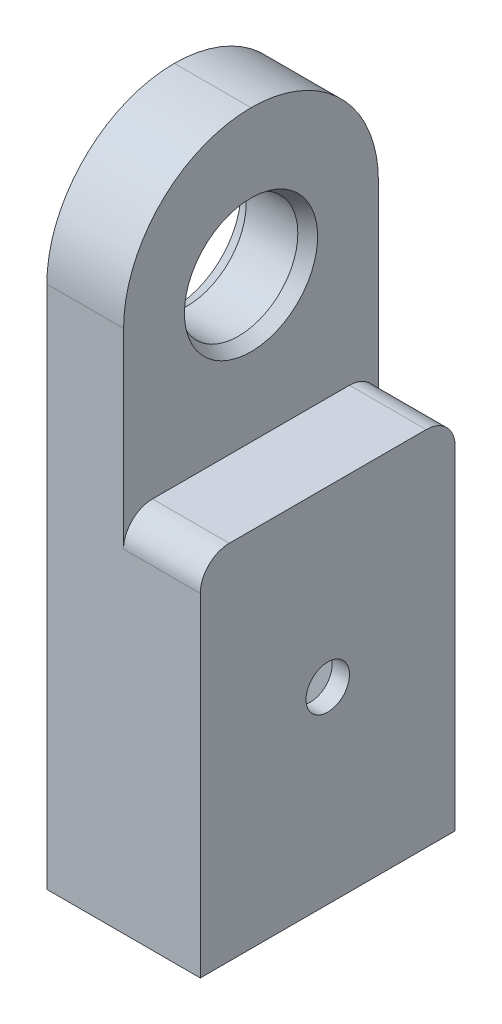
from build123d import *
from OCP.BRepFilletAPI import BRepFilletAPI_MakeChamfer

# Parameters (mm, degrees)
SKETCH1_W           = 10.6
SKETCH1_H           = 17.6
BOSS_EXTRUDE1_DEPTH = 25
SKETCH2_W           = 8.2
SKETCH2_H           = 15.2
CUT_EXTRUDE1_DEPTH  = 23
SKETCH4_W           = 5.3
SKETCH4_H           = 17.6
BOSS_EXTRUDE2_DEPTH = 20
CUT_EXTRUDE2_REACH  = 48.158
SKETCH5_R           = 4.1
FILLET1_R           = 8.8
FILLET2_R           = 2
SKETCH6_R           = 1.5
CUT_EXTRUDE3_DEPTH  = 48.061661679
CHAMFER1_SIZE       = 0.5
CHAMFER1_SIZE2      = 0.866025404


with BuildPart() as part:
    # Sketch1 → Boss-Extrude1 (new body)
    with BuildSketch(Plane(origin=(0, 0, 0), x_dir=(1, 0, 0), z_dir=(0, 1, 0))):
        Rectangle(SKETCH1_W, SKETCH1_H)
    extrude(amount=BOSS_EXTRUDE1_DEPTH)

    # Sketch2 → Cut-Extrude1 (cut)
    with BuildSketch(Plane.XZ):
        Rectangle(SKETCH2_W, SKETCH2_H)
    extrude(amount=-CUT_EXTRUDE1_DEPTH, mode=Mode.SUBTRACT)

    # Sketch4 → Boss-Extrude2 (add)
    with BuildSketch(Plane(origin=(0, 25, 0), x_dir=(1, 0, 0), z_dir=(0, 1, 0))):
        with Locations((-2.65, 0)):
            Rectangle(SKETCH4_W, SKETCH4_H)
    extrude(amount=BOSS_EXTRUDE2_DEPTH)

    # Sketch5 → Cut-Extrude2 (cut, up to next)
    with BuildSketch(Plane(origin=(0, 0, 0), x_dir=(0, 0, -1), z_dir=(1, 0, 0)), mode=Mode.PRIVATE) as cut_extrude2_sk1:
        with Locations((0, 35)):
            Circle(SKETCH5_R)
    cut_extrude2_tool1 = extrude(cut_extrude2_sk1.sketch, amount=-CUT_EXTRUDE2_REACH, mode=Mode.PRIVATE) & part.part
    add(cut_extrude2_tool1.solids().sort_by_distance((0, 35, 0))[0], mode=Mode.SUBTRACT)

    # Fillet1
    fillet1_edges = [part.edges().sort_by_distance(p)[0] for p in [
        (-2.65, 45, -8.8),
        (-2.65, 45, 8.8),
    ]]
    fillet(fillet1_edges, radius=FILLET1_R - 0.0001)  # a hair under: the kernel refuses the full size

    # Fillet2
    fillet2_edges = [part.edges().sort_by_distance(p)[0] for p in [
        (2.65, 25, 8.8),
        (2.65, 25, -8.8),
    ]]
    fillet(fillet2_edges, radius=FILLET2_R)

    # Sketch6 → Cut-Extrude3 (cut, through all)
    with BuildSketch(Plane(origin=(5.3, 0, 0), x_dir=(0, 0, -1), z_dir=(1, 0, 0))):
        with Locations((0, 13)):
            Circle(SKETCH6_R)
    extrude(amount=-CUT_EXTRUDE3_DEPTH, mode=Mode.SUBTRACT)

    # Chamfer1: one chamfer whose edges measure the first distance from different faces: ONE call of the kernel's chamfer builder (chamfer() names one face for all edges)
    chamfer1_edges_1 = [part.edges().sort_by_distance(p)[0] for p in [
        (0, 35, 4.1),
    ]]
    chamfer1_side_1 = [part.faces().sort_by_distance(p)[0] for p in [
        (0, 25.281737466, 0),
    ]]
    chamfer1_edges_2 = [part.edges().sort_by_distance(p)[0] for p in [
        (-5.3, 35, 4.1),
    ]]
    chamfer1_side_2 = [part.faces().sort_by_distance(p)[0] for p in [
        (-5.3, 20.674988238, 0),
    ]]
    chamfer1 = BRepFilletAPI_MakeChamfer(part.part.solid().wrapped)
    for e in chamfer1_edges_1:
        chamfer1.Add(CHAMFER1_SIZE, CHAMFER1_SIZE2, e.wrapped, chamfer1_side_1[0].wrapped)  # the first distance lies on this face
    for e in chamfer1_edges_2:
        chamfer1.Add(CHAMFER1_SIZE, CHAMFER1_SIZE2, e.wrapped, chamfer1_side_2[0].wrapped)  # the first distance lies on this face
    add(Compound.cast(chamfer1.Shape()), mode=Mode.REPLACE)


solid = part.part
